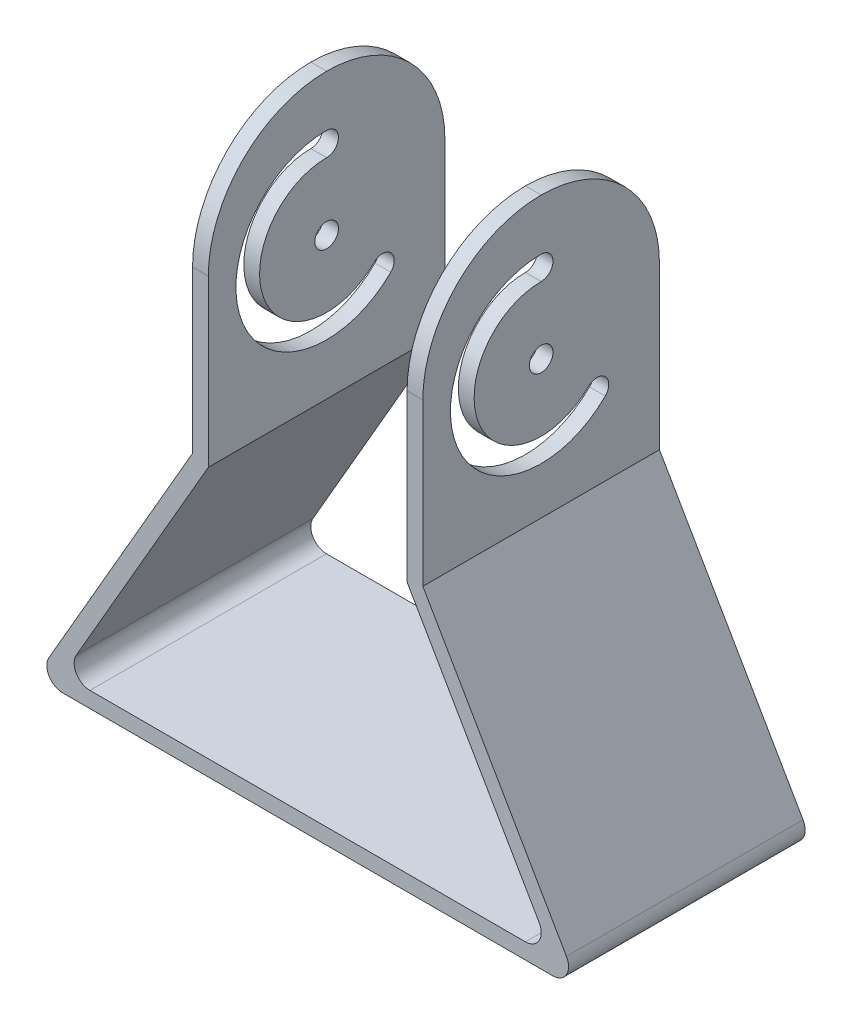
from build123d import *

# Parameters (mm, degrees)
SALIENTE_EXTRUIR1_DEPTH = 150
CROQUIS2_R              = 7.5
CORTAR_EXTRUIR1_DEPTH   = 146
REDONDEO1_R             = 75
REDONDEO2_R             = 10


with BuildPart() as part:
    # Croquis1 → Saliente-Extruir1 (new body)
    with BuildSketch(Plane.XY):
        Polygon((-245.696551146, 350), (-245.696551146, 172.679491924), (-345.393102292, 0), (0, 0), (-99.696551146, 172.679491924), (-99.696551146, 350), (-109.696551146, 350), (-109.696551146, 170), (-17.320508076, 10), (-328.072594216, 10), (-235.696551146, 170), (-235.696551146, 350), align=None)
    extrude(amount=SALIENTE_EXTRUIR1_DEPTH)

    # Croquis2 → Cortar-Extruir1 (cut)
    with BuildSketch(Plane.ZY.offset(245.696551146)):
        with Locations(Location((75, 260, 0), (0, 0, 270))):
            Circle(CROQUIS2_R)
        with BuildLine():
            ThreePointArc((34.341360082, 219.341360082), (128.123073119, 237.995702639), (75, 317.5))
            ThreePointArc((75, 317.5), (67.5, 310), (75, 302.5))
            ThreePointArc((75, 302.5), (114.264880132, 243.735954124), (44.9479618, 229.9479618))
            ThreePointArc((44.9479618, 229.9479618), (34.341360082, 229.9479618), (34.341360082, 219.341360082))
        make_face()
    extrude(amount=-CORTAR_EXTRUIR1_DEPTH, mode=Mode.SUBTRACT)

    # Redondeo1
    redondeo1_edges = [part.edges().sort_by_distance(p)[0] for p in [
        (-104.696551146, 350, 0),
        (-104.696551146, 350, 150),
        (-240.696551146, 350, 150),
        (-240.696551146, 350, 0),
    ]]
    fillet(redondeo1_edges, radius=REDONDEO1_R - 0.0001)  # a hair under: the kernel refuses the full size

    # Redondeo2
    redondeo2_edges = [part.edges().sort_by_distance(p)[0] for p in [
        (-328.072594216, 10, 75),
        (-17.320508076, 10, 75),
        (0, 0, 75),
        (-345.393102292, 0, 75),
    ]]
    fillet(redondeo2_edges, radius=REDONDEO2_R)


solid = part.part
